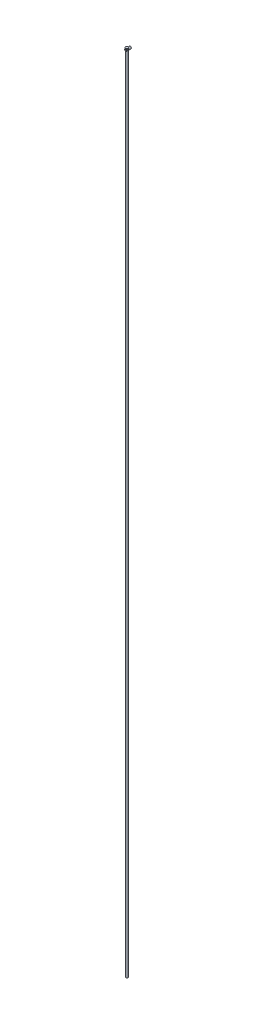
from build123d import *

# Parameters (mm, degrees)
CROQUIS1_R                 = 12.7
CROQUIS1_R_2               = 10
SALIENTE_EXTRUIR1_DEPTH    = 50
SALIENTE_EXTRUIR2_START    = -8969.1
SALIENTE_EXTRUIR2_DEPTH    = 8994.5
CORTAR_EXTRUIR1_DEPTH      = 8970.248357687
CORTAR_EXTRUIR1_DEPTH_BACK = 8970.248357687
CROQUIS3_R                 = 10
CROQUIS4_R                 = 10
CORTAR_EXTRUIR2_DEPTH      = 42
CROQUIS5_R                 = 14.5
SALIENTE_EXTRUIR4_DEPTH    = 5


# Read off the part's stored shape, not the designer's step: Saliente-Extruir2
with BuildPart() as part:
    # Croquis1 → Saliente-Extruir1 (new body)
    with BuildSketch(Plane.XY):
        Circle(CROQUIS1_R)
        Circle(CROQUIS1_R_2, mode=Mode.SUBTRACT)
    extrude(amount=SALIENTE_EXTRUIR1_DEPTH)

    # Saliente-Extruir2 outline → Saliente-Extruir2 (add)
    with BuildSketch(Plane(origin=(0, -12.7, 0), x_dir=(1, 0, 0), z_dir=(0, 1, 0)).offset(SALIENTE_EXTRUIR2_START)):
        with BuildLine():
            ThreePointArc((-10.00000081, -45.078791975), (0.000421906, -49.949999993), (10.000520948, -45.07812754))
            ThreePointArc((10.000520948, -45.07812754), (-0.000421906, -24.550000007), (-10.00000081, -45.078791975))
        make_face()
    extrude(amount=SALIENTE_EXTRUIR2_DEPTH)

    # Croquis3 → Cortar-Extruir1 (cut, two sides: drawn at the far end of the back side and taken through both)
    with BuildSketch(Plane(origin=(0, -12.7, 0), x_dir=(1, 0, 0), z_dir=(0, 1, 0)).offset(-CORTAR_EXTRUIR1_DEPTH_BACK)):
        with Locations(Location((0, -37.25, 0), (0, 0, 270))):
            Circle(CROQUIS3_R)
    extrude(amount=CORTAR_EXTRUIR1_DEPTH + CORTAR_EXTRUIR1_DEPTH_BACK, mode=Mode.SUBTRACT)

    # Croquis4 → Cortar-Extruir2 (cut)
    with BuildSketch(Plane.XY):
        with Locations(Location((0, 0, 0), (0, 0, 180))):
            Circle(CROQUIS4_R)
    extrude(amount=CORTAR_EXTRUIR2_DEPTH, mode=Mode.SUBTRACT)


with BuildPart() as body_2:
    # Croquis5 → Saliente-Extruir4 (new body)
    with BuildSketch(Plane(origin=(0, 12.7, 0), x_dir=(1, 0, 0), z_dir=(0, 1, 0))):
        with Locations(Location((0, -37.25, 0), (0, 0, 270))):
            Circle(CROQUIS5_R)
    extrude(amount=SALIENTE_EXTRUIR4_DEPTH)


solid = Compound([part.part, body_2.part])
